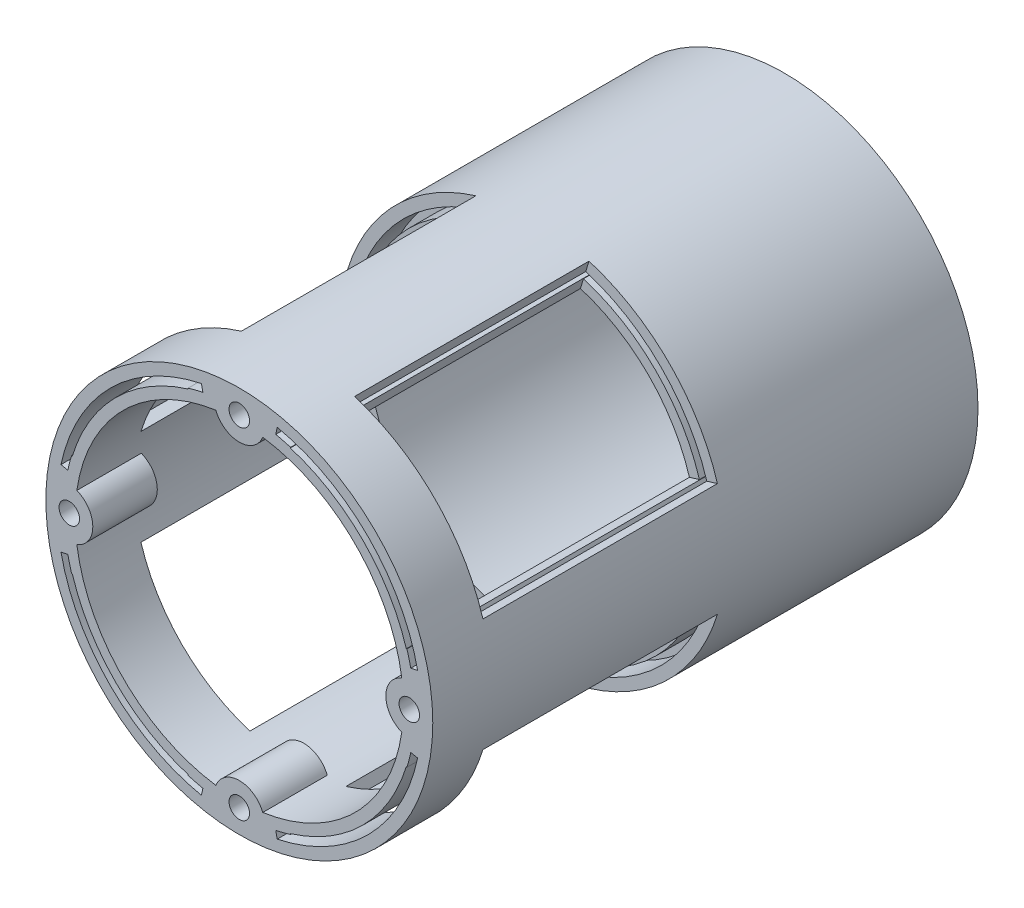
from build123d import *

# Parameters (mm, degrees)
CROQUIS1_R               = 33
CROQUIS1_R_2             = 28
BOSS_EXTRUDE1_DEPTH      = 93
CORTAR_EXTRUIR1_DEPTH    = 55
CORTAR_REVOLUCI_N2_ANGLE = 56
MATRIZC2_COUNT           = 4
BOSS_EXTRUDE4_DEPTH      = 11
SKETCH9_R                = 1.75
CUT_EXTRUDE3_DEPTH       = 10


with BuildPart() as part:
    # Croquis1 → Boss-Extrude1 (new body)
    with BuildSketch(Plane.XY):
        Circle(CROQUIS1_R)
        Circle(CROQUIS1_R_2, mode=Mode.SUBTRACT)
    extrude(amount=BOSS_EXTRUDE1_DEPTH)

    # Croquis2 → Cortar-Extruir1 (cut)
    with BuildSketch(Plane.XY.offset(93)):
        with BuildLine():
            Line((-30.420390383, -6.466053584), (-29.246613262, -6.216559555))
            ThreePointArc((-29.246613262, -6.216559555), (-21.142492757, -21.142492757), (-6.216559555, -29.246613262))
            Line((-6.216559555, -29.246613262), (-6.466053584, -30.420390383))
            ThreePointArc((-6.466053584, -30.420390383), (-21.991020895, -21.991020895), (-30.420390383, -6.466053584))
        make_face()
        with BuildLine():
            Line((-30.420390383, 6.466053584), (-29.246613262, 6.216559555))
            ThreePointArc((-29.246613262, 6.216559555), (-21.142492757, 21.142492757), (-6.216559555, 29.246613262))
            Line((-6.216559555, 29.246613262), (-6.466053584, 30.420390383))
            ThreePointArc((-6.466053584, 30.420390383), (-21.991020895, 21.991020895), (-30.420390383, 6.466053584))
        make_face()
        with BuildLine():
            Line((6.466053584, 30.420390383), (6.216559555, 29.246613262))
            ThreePointArc((6.216559555, 29.246613262), (21.142492757, 21.142492757), (29.246613262, 6.216559555))
            Line((29.246613262, 6.216559555), (30.420390383, 6.466053584))
            ThreePointArc((30.420390383, 6.466053584), (21.991020895, 21.991020895), (6.466053584, 30.420390383))
        make_face()
        with BuildLine():
            Line((30.420390383, -6.466053584), (29.246613262, -6.216559555))
            ThreePointArc((29.246613262, -6.216559555), (21.142492757, -21.142492757), (6.216559555, -29.246613262))
            Line((6.216559555, -29.246613262), (6.466053584, -30.420390383))
            ThreePointArc((6.466053584, -30.420390383), (21.991020895, -21.991020895), (30.420390383, -6.466053584))
        make_face()
    extrude(amount=-CORTAR_EXTRUIR1_DEPTH, mode=Mode.SUBTRACT)

    # Croquis4 → Cortar-Revolución2 (revolve, cut)
    with BuildSketch(Plane(origin=(0, 0, 0), x_dir=(0, 0, -1), z_dir=(0.9563047559630335, -0.29237170472274326, 0))):
        Polygon((-83, 33), (-83, 30.983938292), (-93, 30.983938292), (-93, 29.783938292), (-83, 29.783938292), (-83, 27.767876584), (-43, 27.767876584), (-43, 29.783938292), (-38, 29.783938292), (-38, 30.983938292), (-43, 30.983938292), (-43, 33), align=None)
    cortar_revoluci_n2 = revolve(axis=Axis((0, 0, 93), (0, 0, -1)), revolution_arc=CORTAR_REVOLUCI_N2_ANGLE, mode=Mode.SUBTRACT)

    # MatrizC2: Cortar-Revolución2 ×4 about axis
    matrizc2_axis = Axis((0, 0, 93), (0, 0, -1))
    for i in range(1, MATRIZC2_COUNT):
        add(cortar_revoluci_n2.rotate(matrizc2_axis, i * 360 / MATRIZC2_COUNT), mode=Mode.SUBTRACT)

    # Sketch8 → Boss-Extrude4 (add)
    with BuildSketch(Plane(origin=(0, 0, 0), x_dir=(-1, 0, 0), z_dir=(0, 0, -1))):
        with BuildLine():
            ThreePointArc((-4, -27.712812921), (0, -28), (4, -27.712812921))
            ThreePointArc((4, -27.712812921), (0, -24.990786305), (-4, -27.712812921))
        make_face()
        with BuildLine():
            ThreePointArc((-27.712812921, 4), (-28, 0), (-27.712812921, -4))
            ThreePointArc((-27.712812921, -4), (-24.990786305, 0), (-27.712812921, 4))
        make_face()
        with BuildLine():
            ThreePointArc((4, 27.712812921), (0, 28), (-4, 27.712812921))
            ThreePointArc((-4, 27.712812921), (0, 24.990786305), (4, 27.712812921))
        make_face()
        with BuildLine():
            ThreePointArc((27.712812921, -4), (28, 0), (27.712812921, 4))
            ThreePointArc((27.712812921, 4), (24.990786305, 0), (27.712812921, -4))
        make_face()
    boss_extrude4 = extrude(amount=-BOSS_EXTRUDE4_DEPTH)

    # Sketch9 → Cut-Extrude3 (cut)
    with BuildSketch(Plane(origin=(0, 0, 0), x_dir=(-1, 0, 0), z_dir=(0, 0, -1))):
        with Locations((0, -29)):
            Circle(SKETCH9_R)
        with Locations((-29, 0)):
            Circle(SKETCH9_R)
        with Locations((0, 29)):
            Circle(SKETCH9_R)
        with Locations((29, 0)):
            Circle(SKETCH9_R)
    cut_extrude3 = extrude(amount=-CUT_EXTRUDE3_DEPTH, mode=Mode.SUBTRACT)

    # Mirror1: Boss-Extrude4, Cut-Extrude3 across plane
    add(boss_extrude4.mirror(Plane.XY.offset(46.5)))
    add(cut_extrude3.mirror(Plane.XY.offset(46.5)), mode=Mode.SUBTRACT)


solid = part.part
